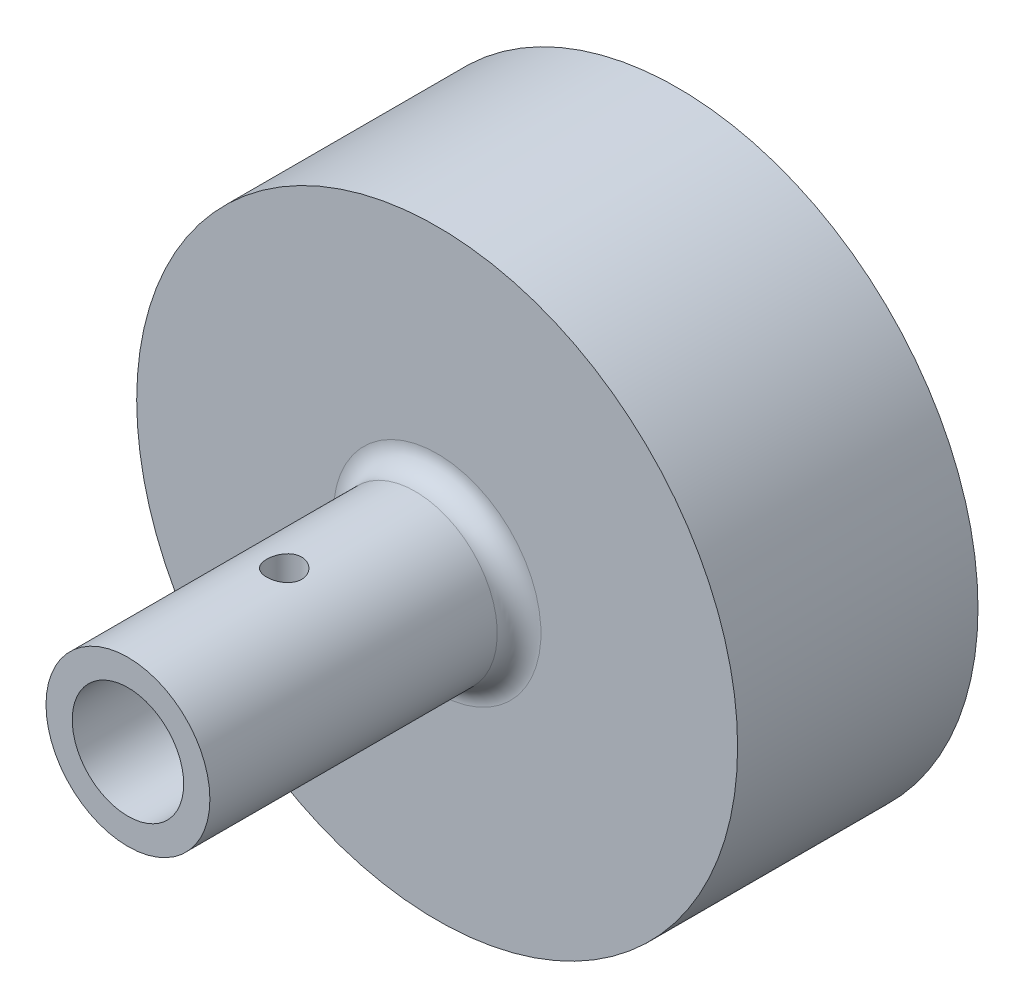
from build123d import *

# Parameters (mm, degrees)
SKETCH1_R               = 7.5
SKETCH1_R_2             = 5.1
BOSS_EXTRUDE1_DEPTH     = 28.3
SKETCH4_R               = 27.5
BOSS_EXTRUDE3_DEPTH     = 22
FILLET1_R               = 2
SKETCH5_R               = 2.125
CUT_EXTRUDE2_DEPTH      = 20
BOSS_EXTRUDE4_DEPTH     = 20
CUT_EXTRUDE3_DEPTH      = 49.097713043
CUT_EXTRUDE3_DEPTH_BACK = 49.097713043
SKETCH7_R               = 1.6


with BuildPart() as part:
    # Sketch1 → Boss-Extrude1 (new body)
    with BuildSketch(Plane.XY):
        Circle(SKETCH1_R)
        Circle(SKETCH1_R_2, mode=Mode.SUBTRACT)
    extrude(amount=BOSS_EXTRUDE1_DEPTH)

    # Sketch4 → Boss-Extrude3 (add)
    with BuildSketch(Plane(origin=(0, 0, 0), x_dir=(-1, 0, 0), z_dir=(0, 0, -1))):
        Circle(SKETCH4_R)
    extrude(amount=BOSS_EXTRUDE3_DEPTH)

    # Fillet1
    fillet1_edges = [part.edges().sort_by_distance(p)[0] for p in [
        (-7.5, 0, 0),
    ]]
    fillet(fillet1_edges, radius=FILLET1_R)

    # Sketch5 → Cut-Extrude2 (cut)
    with BuildSketch(Plane(origin=(0, 0, -22), x_dir=(-1, 0, 0), z_dir=(0, 0, -1))):
        with Locations((0, 12)):
            Circle(SKETCH5_R)
        with Locations((12, 0)):
            Circle(SKETCH5_R)
        with Locations((0, -12)):
            Circle(SKETCH5_R)
        with Locations((-12, 0)):
            Circle(SKETCH5_R)
    extrude(amount=-CUT_EXTRUDE2_DEPTH, mode=Mode.SUBTRACT)

    # Sketch6 → Boss-Extrude4 (add)
    with BuildSketch(Plane.XY):
        with BuildLine():
            ThreePointArc((3.163858404, 4), (0, 5.1), (-3.163858404, 4))
            Line((-3.163858404, 4), (3.163858404, 4))
        make_face()
    extrude(amount=BOSS_EXTRUDE4_DEPTH)

    # Sketch7 → Cut-Extrude3 (cut, two sides: drawn at the far end of the back side and taken through both)
    with BuildSketch(Plane(origin=(0, 0, 0), x_dir=(1, 0, 0), z_dir=(0, 1, 0)).offset(-CUT_EXTRUDE3_DEPTH_BACK)):
        with Locations((0, -14)):
            Circle(SKETCH7_R)
    extrude(amount=CUT_EXTRUDE3_DEPTH + CUT_EXTRUDE3_DEPTH_BACK, mode=Mode.SUBTRACT)


solid = part.part
